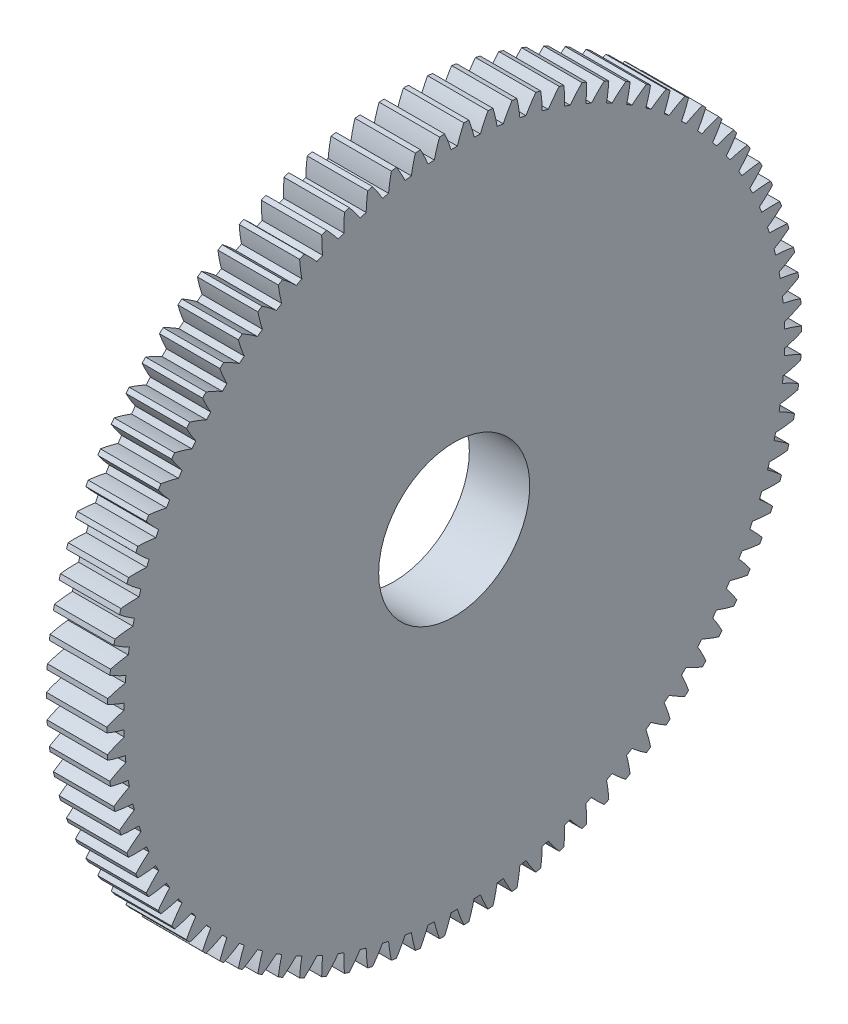
from build123d import *

# Parameters (mm, degrees)
BASPROSKE_W     = 4
BASPROSKE_H     = 23
TOOTHCUT_DEPTH  = 33.771939216
TEETHCUTS_COUNT = 90
TEETHCUTS_ANGLE = 356
BORSKE_R        = 5
BORE_DEPTH      = 50.0000508


with BuildPart() as part:
    # BasProSke → Base-Revolve (revolve)
    with BuildSketch(Plane(origin=(0, 0, 0), x_dir=(1, 0, 0), z_dir=(0, 1, 0))):
        with Locations((2, 11.5)):
            Rectangle(BASPROSKE_W, BASPROSKE_H)
    revolve(axis=Axis((-10, 0, 0), (1, 0, 0)))

    # TooCutSke → ToothCut (cut, through all)
    with BuildSketch(Plane(origin=(0, 0, 0), x_dir=(0, 0, -1), z_dir=(1, 0, 0))):
        with BuildLine():
            ThreePointArc((0.208497677, 21.873006303), (0, 21.874), (-0.208497677, 21.873006303))
            ThreePointArc((-0.208497677, 21.873006303), (-0.408932112, 22.452130021), (-0.648312723, 23.016271109))
            ThreePointArc((-0.648312723, 23.016271109), (0, 23.0254), (0.648312723, 23.016271109))
            ThreePointArc((0.648312723, 23.016271109), (0.408932112, 22.452130021), (0.208497677, 21.873006303))
        make_face()
    toothcut = extrude(amount=TOOTHCUT_DEPTH, mode=Mode.SUBTRACT)

    # TeethCuts: ToothCut ×90 about axis
    teethcuts_axis = Axis((-10, 0, 0), (1, 0, 0))
    for i in range(1, TEETHCUTS_COUNT):
        add(toothcut.rotate(teethcuts_axis, i * TEETHCUTS_ANGLE / (TEETHCUTS_COUNT - 1)), mode=Mode.SUBTRACT)

    # BorSke → Bore (cut, symmetric)
    with BuildSketch(Plane(origin=(0, 0, 0), x_dir=(0, 0, -1), z_dir=(1, 0, 0))):
        Circle(BORSKE_R)
    extrude(amount=BORE_DEPTH, both=True, mode=Mode.SUBTRACT)


solid = part.part
